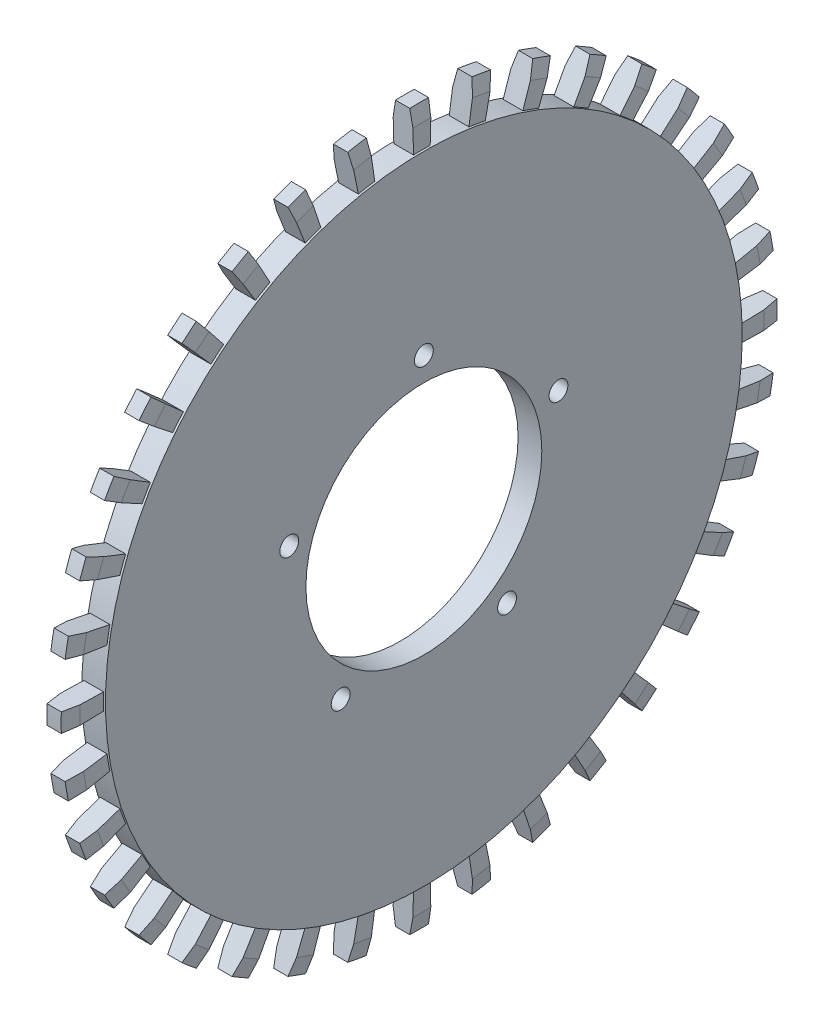
from build123d import *

# Parameters (mm, degrees)
SKETCH1_R           = 67.48
BOSS_EXTRUDE1_DEPTH = 5.03
REVOLVE2_ANGLE      = 3
CIRPATTERN1_COUNT   = 36
SKETCH4_R           = 25
CUT_EXTRUDE1_DEPTH  = 108.414220195
SKETCH5_R           = 2
CUT_EXTRUDE2_DEPTH  = 10
CIRPATTERN2_COUNT   = 5


# Read off the part's stored shape, not the designer's step: Revolve2
with BuildPart() as part:
    # Sketch1 → Boss-Extrude1 (new body)
    with BuildSketch(Plane(origin=(0, 0, 0), x_dir=(0, 0, -1), z_dir=(1, 0, 0))):
        Circle(SKETCH1_R)
    extrude(amount=BOSS_EXTRUDE1_DEPTH)

    # Revolve2 outline → Revolve2 (revolve)
    with BuildSketch(Plane(origin=(0, 0, 0), x_dir=(0, 0.9996573249755573, -0.02617694830787336), z_dir=(0, -0.02617694830787336, -0.9996573249755573))):
        Polygon((72.48, 4.605), (67.48, 4.605), (67.48, 0.425), (72.48, 0.425), (75.87, 1), (75.87, 4.03), align=None)
    revolve2 = revolve(axis=Axis((0, 0, 0), (1, 0, 0)), revolution_arc=REVOLVE2_ANGLE)

    # CirPattern1: Revolve2 ×36 about axis
    cirpattern1_axis = Axis((0, 0, 0), (1, 0, 0))
    for i in range(1, CIRPATTERN1_COUNT):
        add(revolve2.rotate(cirpattern1_axis, i * 360 / CIRPATTERN1_COUNT))

    # Sketch4 → Cut-Extrude1 (cut, through all)
    with BuildSketch(Plane(origin=(5.03, 0, 0), x_dir=(0, 0, -1), z_dir=(1, 0, 0))):
        Circle(SKETCH4_R)
    extrude(amount=-CUT_EXTRUDE1_DEPTH, mode=Mode.SUBTRACT)

    # Sketch5 → Cut-Extrude2 (cut)
    with BuildSketch(Plane(origin=(5.03, 0, 0), x_dir=(0, 0, -1), z_dir=(1, 0, 0))):
        with Locations((0, 30)):
            Circle(SKETCH5_R)
    cut_extrude2 = extrude(amount=-CUT_EXTRUDE2_DEPTH, mode=Mode.SUBTRACT)

    # CirPattern2: Cut-Extrude2 ×5 about axis
    cirpattern2_axis = Axis((0, 0, 0), (1, 0, 0))
    for i in range(1, CIRPATTERN2_COUNT):
        add(cut_extrude2.rotate(cirpattern2_axis, i * 360 / CIRPATTERN2_COUNT), mode=Mode.SUBTRACT)


solid = part.part
